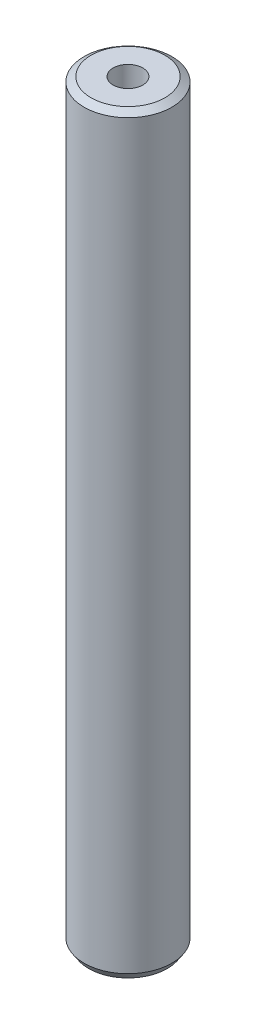
from build123d import *
from OCP.BRepFilletAPI import BRepFilletAPI_MakeChamfer

# Parameters (mm, degrees)
SKETCH1_R           = 35
BOSS_EXTRUDE1_DEPTH = 600
SKETCH2_R           = 11.814984261
CUT_EXTRUDE1_DEPTH  = 603.038204768
CHAMFER1_SIZE       = 3.701610982
CHAMFER1_SIZE2      = 5.589681085


with BuildPart() as part:
    # Sketch1 → Boss-Extrude1 (new body)
    with BuildSketch(Plane(origin=(0, 0, 0), x_dir=(1, 0, 0), z_dir=(0, 1, 0))):
        Circle(SKETCH1_R)
    extrude(amount=BOSS_EXTRUDE1_DEPTH)

    # Sketch2 → Cut-Extrude1 (cut, through all)
    with BuildSketch(Plane(origin=(0, 0, 0), x_dir=(1, 0, 0), z_dir=(0, 1, 0))):
        Circle(SKETCH2_R)
    extrude(amount=CUT_EXTRUDE1_DEPTH, mode=Mode.SUBTRACT)

    # Chamfer1: one chamfer whose edges measure the first distance from different faces: ONE call of the kernel's chamfer builder (chamfer() names one face for all edges)
    chamfer1_edges_1 = [part.edges().sort_by_distance(p)[0] for p in [
        (-35, 600, 0),
    ]]
    chamfer1_side_1 = [part.faces().sort_by_distance(p)[0] for p in [
        (-35, 300, 0),
    ]]
    chamfer1_edges_2 = [part.edges().sort_by_distance(p)[0] for p in [
        (-35, 0, 0),
    ]]
    chamfer1_side_2 = [part.faces().sort_by_distance(p)[0] for p in [
        (-34.010050506, 0, 0),
    ]]
    chamfer1 = BRepFilletAPI_MakeChamfer(part.part.solid().wrapped)
    for e in chamfer1_edges_1:
        chamfer1.Add(CHAMFER1_SIZE, CHAMFER1_SIZE2, e.wrapped, chamfer1_side_1[0].wrapped)  # the first distance lies on this face
    for e in chamfer1_edges_2:
        chamfer1.Add(CHAMFER1_SIZE, CHAMFER1_SIZE2, e.wrapped, chamfer1_side_2[0].wrapped)  # the first distance lies on this face
    add(Compound.cast(chamfer1.Shape()), mode=Mode.REPLACE)


solid = part.part
